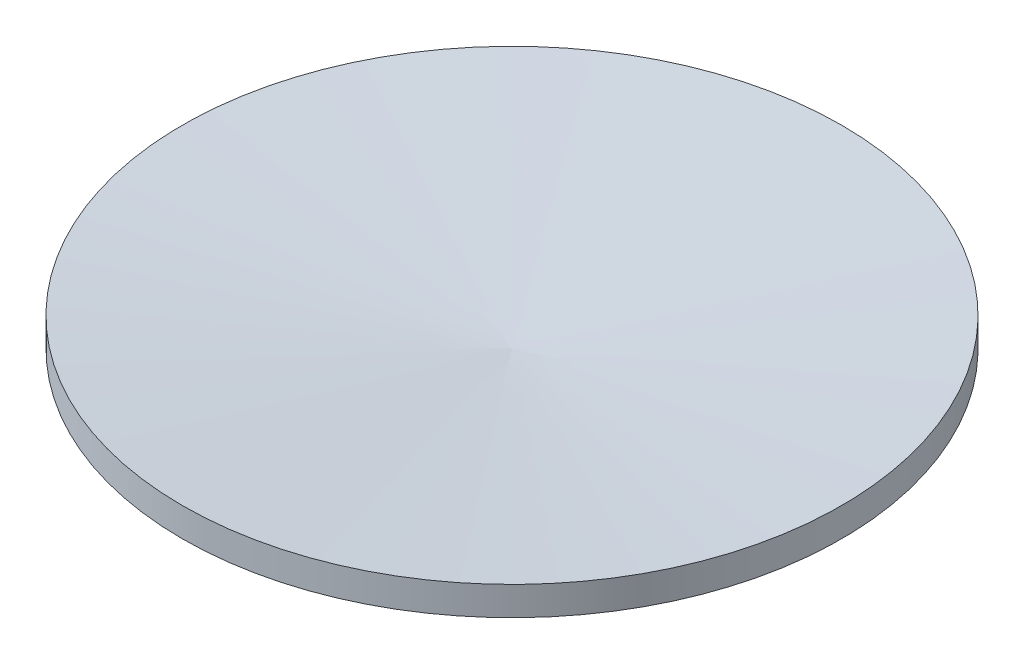
from build123d import *


with BuildPart() as part:
    # 草图1 → 旋转1 (revolve)
    with BuildSketch(Plane.XY):
        Polygon((0, 0), (125.040026559, 10.939584811), (125.040026559, 0), align=None)
    revolve(axis=Axis((-0.01, 0, 0), (0, 1, 0)))


solid = part.part
